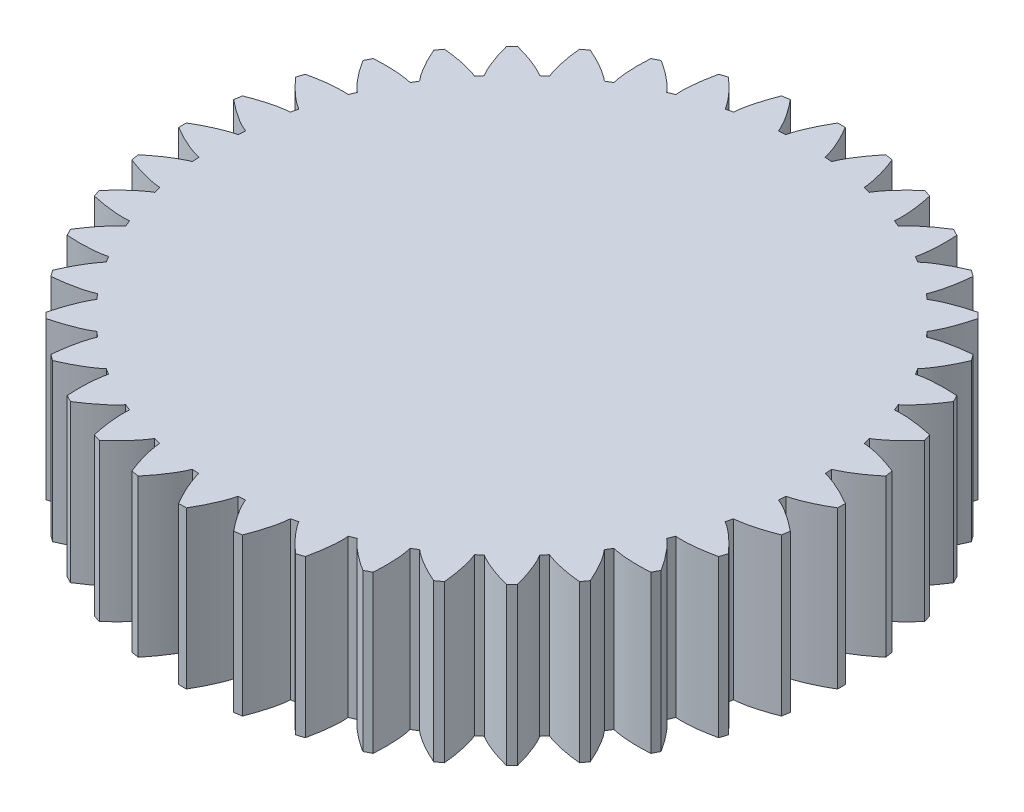
from build123d import *

# Parameters (mm, degrees)
BOSS_EXTRUDE1_DEPTH = 10
CIRPATTERN1_COUNT   = 40


with BuildPart() as part:
    # Sketch1 → Boss-Extrude1 (new body)
    with BuildSketch(Plane(origin=(0, 0, 0), x_dir=(1, 0, 0), z_dir=(0, 1, 0))):
        with BuildLine():
            Line((-1.695107839, 18.673219043), (0, 0))
            Line((0, 0), (1.249926438, 18.708291849))
            add(Edge.make_bspline(
                [(1.249926438, 18.708291849), (1.249272195, 18.711945618), (1.247349347, 18.722179246), (1.243366912, 18.741471084), (1.236373902, 18.772878716), (1.226735228, 18.812795505), (1.213438195, 18.864279915), (1.196692617, 18.924795602), (1.177153344, 18.991169448), (1.15466517, 19.063247905), (1.131139264, 19.135044267), (1.106652694, 19.206565324), (1.081340123, 19.277724691), (1.049587433, 19.363824091), (1.0099947, 19.466932887), (0.961494127, 19.58727291), (0.903856958, 19.723556814), (0.842284216, 19.862265474), (0.779366099, 19.998606959), (0.713097059, 20.136216284), (0.647065698, 20.269259306), (0.57569005, 20.407334492), (0.508391431, 20.534721789), (0.429881233, 20.677343755), (0.365617383, 20.792408729), (0.296620927, 20.911209366), (0.262653486, 20.969022661), (0.245128896, 20.99856928)],
                knots=[0, 0, 0, 0, 0, 0.005376749, 0.015083688, 0.02853182, 0.04661014, 0.06485485, 0.092110526, 0.119476176, 0.146842496, 0.174208854, 0.201574956, 0.228941013, 0.256307345, 0.307035032, 0.361767352, 0.416499661, 0.471231937, 0.525964282, 0.580696616, 0.635428982, 0.690161387, 0.744893688, 0.799626082, 0.854358407, 0.909092435, 0.909092435, 0.909092435, 0.909092435, 0.909092435], degree=4))
            ThreePointArc((0.245128896, 20.99856928), (0, 21), (-0.245128896, 20.99856928))
            add(Edge.make_bspline(
                [(-1.249926438, 18.708291849), (-1.249272195, 18.711945618), (-1.247349347, 18.722179246), (-1.243366912, 18.741471084), (-1.236373902, 18.772878716), (-1.226735228, 18.812795505), (-1.213438195, 18.864279915), (-1.196692617, 18.924795602), (-1.177153344, 18.991169448), (-1.15466517, 19.063247905), (-1.131139264, 19.135044267), (-1.106652694, 19.206565324), (-1.081340123, 19.277724691), (-1.049587433, 19.363824091), (-1.0099947, 19.466932887), (-0.961494127, 19.58727291), (-0.903856958, 19.723556814), (-0.842284216, 19.862265474), (-0.779366099, 19.998606959), (-0.713097059, 20.136216284), (-0.647065698, 20.269259306), (-0.57569005, 20.407334492), (-0.508391431, 20.534721789), (-0.429881233, 20.677343755), (-0.365617383, 20.792408729), (-0.296620927, 20.911209366), (-0.262653486, 20.969022661), (-0.245128896, 20.99856928)],
                knots=[0, 0, 0, 0, 0, 0.005376749, 0.015083688, 0.02853182, 0.04661014, 0.06485485, 0.092110526, 0.119476176, 0.146842496, 0.174208854, 0.201574956, 0.228941013, 0.256307345, 0.307035032, 0.361767352, 0.416499661, 0.471231937, 0.525964282, 0.580696616, 0.635428982, 0.690161387, 0.744893688, 0.799626082, 0.854358407, 0.909092435, 0.909092435, 0.909092435, 0.909092435, 0.909092435], degree=4))
            ThreePointArc((-1.249926438, 18.708291849), (-1.472621556, 18.69208083), (-1.695107839, 18.673219043))
        make_face()
    boss_extrude1 = extrude(amount=BOSS_EXTRUDE1_DEPTH)

    # CirPattern1: Boss-Extrude1 ×40 about axis
    cirpattern1_axis = Axis((0, 10, 0), (0, -1, 0))
    for i in range(1, CIRPATTERN1_COUNT):
        add(boss_extrude1.rotate(cirpattern1_axis, i * 360 / CIRPATTERN1_COUNT))


solid = part.part
